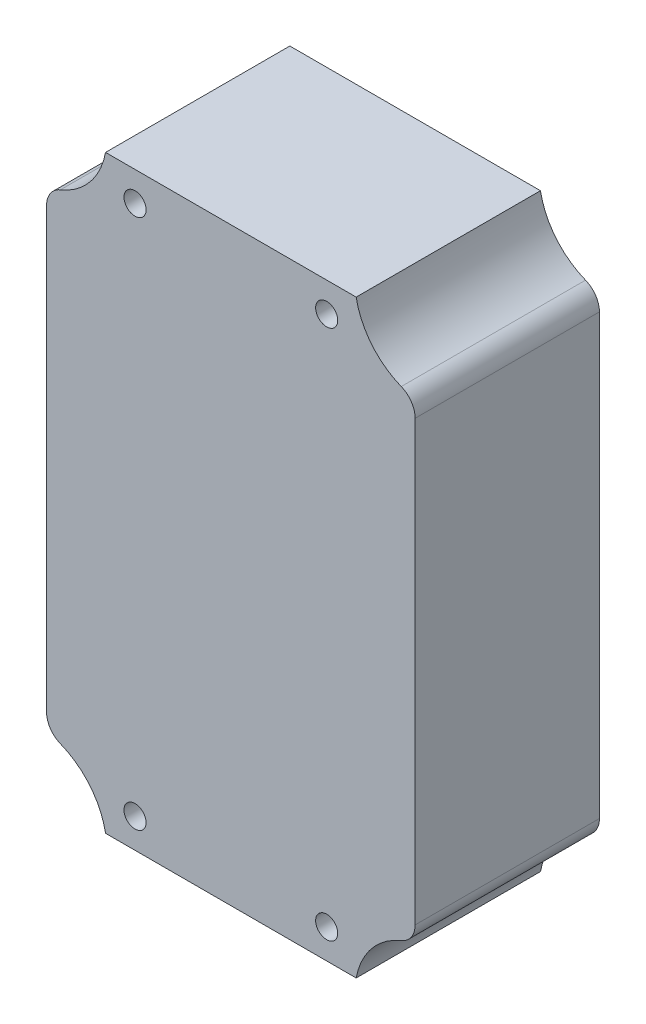
from build123d import *

# Parameters (mm, degrees)
SKETCH_1_R      = 1.5
EXTRUDE_1_DEPTH = 25
FILLET_1_R      = 10
FILLET_2_R      = 3


with BuildPart() as part:
    # 草图1 → 凸台-拉伸1 (new body)
    with BuildSketch(Plane.XY):
        Polygon((-17, 40), (17, 40), (17, 32), (25, 32), (25, -32), (17, -32), (17, -40), (-17, -40), (-17, -32), (-25, -32), (-25, 32), (-17, 32), align=None)
        with Locations((-13, 36)):
            Circle(SKETCH_1_R, mode=Mode.SUBTRACT)
        with Locations(Location((13, 36, 0), (0, 0, 180))):
            Circle(SKETCH_1_R, mode=Mode.SUBTRACT)
        with Locations(Location((-13, -36, 0), (0, 0, 180))):
            Circle(SKETCH_1_R, mode=Mode.SUBTRACT)
        with Locations((13, -36)):
            Circle(SKETCH_1_R, mode=Mode.SUBTRACT)
    extrude(amount=EXTRUDE_1_DEPTH)

    # 圆角1
    # the kernel refuses this fillet: 10 mm, written as the material it adds along each edge
    with BuildSketch(Plane(origin=(17, 32, 0), x_dir=(0, 1, 0), z_dir=(0, 0, 1)), Plane(origin=(-17, 32, 0), x_dir=(-1, 0, 0), z_dir=(0, 0, 1)), Plane(origin=(17, -32, 0), x_dir=(1, 0, 0), z_dir=(0, 0, 1)), Plane(origin=(-17, -32, 0), x_dir=(0, -1, 0), z_dir=(0, 0, 1))) as fillet_1_piece_1:
        with BuildLine():
            CenterArc((9.830951895, -9.830951895), FILLET_1_R, 100.550098012, 68.899803976)
            Line((0, -8), (0, 0))
            Line((0, 0), (8, 0))
        make_face()
    extrude(amount=25)

    # 圆角2
    fillet_2_edges = [part.edges().sort_by_distance(p)[0] for p in [
        (25, 32, 12.5),
        (25, -32, 12.5),
        (-25, -32, 12.5),
        (-25, 32, 12.5),
    ]]
    fillet(fillet_2_edges, radius=FILLET_2_R)


solid = part.part
